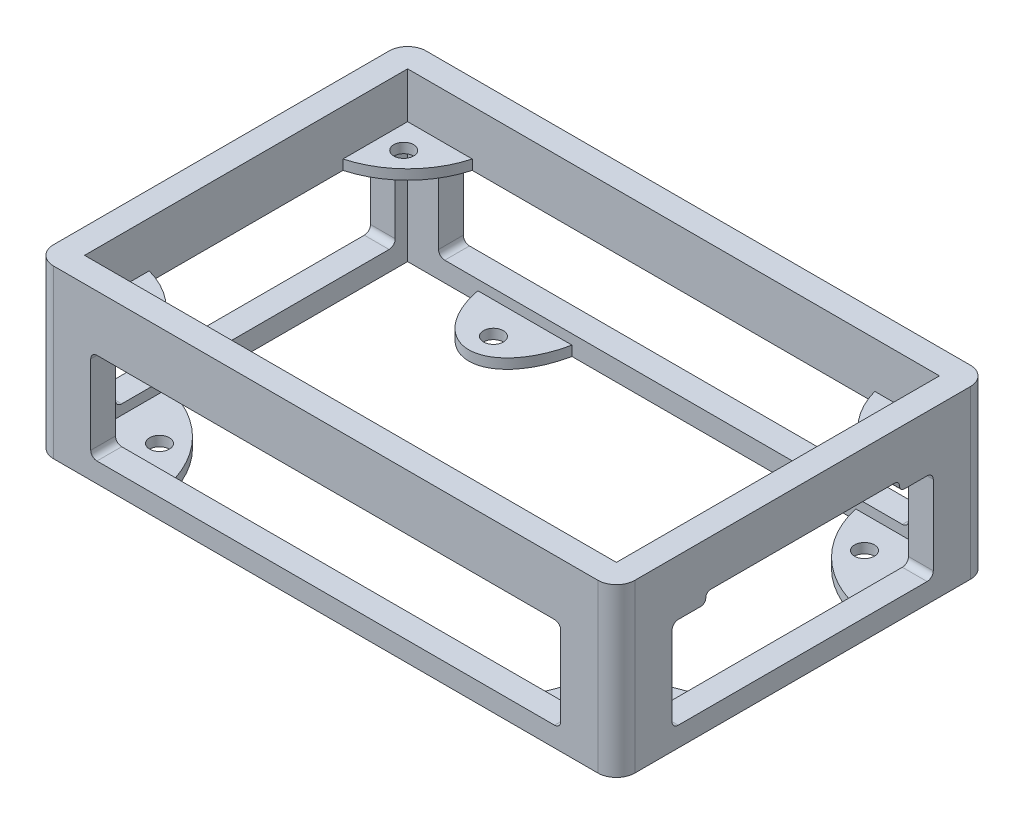
from build123d import *

# Parameters (mm, degrees)
EXTRUDE_1_DEPTH      = 9
EXTRUDE_1_DEPTH_BACK = 18
SKETCH_1_W           = 94
SKETCH_1_H           = 60.24
SKETCH_1_3_R         = 1.6
EXTRUDE_2_DEPTH      = 1.6
SKETCH_2_R           = 1.6
EXTRUDE_3_DEPTH      = 1.6
FILLET_1_R           = 3
SKETCH_3_W           = 42.24
SKETCH_3_H           = 14.8
CUT_EXTRUDE_1_DEPTH  = 4
SKETCH_4_W           = 42.24
SKETCH_4_H           = 14.8
CUT_EXTRUDE_2_DEPTH  = 4
SKETCH_5_W           = 76
SKETCH_5_H           = 14.8
CUT_EXTRUDE_3_DEPTH  = 4
SKETCH_6_W           = 76
SKETCH_6_H           = 14.8
CUT_EXTRUDE_4_DEPTH  = 4
FILLET_2_R           = 1
SKETCH_8_W           = 3
SKETCH_8_H           = 14.8
CUT_EXTRUDE_5_DEPTH  = 4
FILLET_3_R           = 1
SKETCH_9_W           = 31.32633541
SKETCH_9_H           = 1.6
CUT_EXTRUDE_6_DEPTH  = 4
FILLET_5_R           = 0.8


with BuildPart() as part:
    # 草图1 → 凸台-拉伸1 (new, two sides: drawn at the far end of the back side and taken through both)
    with BuildSketch(Plane(origin=(0, 0, 0), x_dir=(1, 0, 0), z_dir=(0, 1, 0)).offset(-EXTRUDE_1_DEPTH_BACK)):
        Rectangle(SKETCH_1_W, SKETCH_1_H)
        Polygon((-43, 15.663167705), (-43, 26.12), (-32.543167705, 26.12), (32.543167705, 26.12), (43, 26.12), (43, 15.663167705), (43, -15.663167705), (43, -26.12), (32.543167705, -26.12), (-32.543167705, -26.12), (-43, -26.12), (-43, -15.663167705), align=None, mode=Mode.SUBTRACT)
    extrude(amount=EXTRUDE_1_DEPTH + EXTRUDE_1_DEPTH_BACK)

    # 草图1<3> → 凸台-拉伸2 (add)
    # profile 1 of 4: a face of its own
    with BuildSketch(Plane(origin=(0, 0, 0), x_dir=(1, 0, 0), z_dir=(0, 1, 0))):
        with BuildLine():
            Line((-32.543167705, 26.12), (-43, 26.12))
            Line((-43, 26.12), (-43, 15.663167705))
            ThreePointArc((-43, 15.663167705), (-36.393398282, 19.513398282), (-32.543167705, 26.12))
        make_face()
        with Locations(Location((-39.3, 21.79, 0), (0, 0, 270))):
            Circle(SKETCH_1_3_R, mode=Mode.SUBTRACT)
    # profile 2 of 4: a face of its own
    with BuildSketch(Plane(origin=(0, 0, 0), x_dir=(1, 0, 0), z_dir=(0, 1, 0))):
        with BuildLine():
            Line((32.543167705, 26.12), (43, 26.12))
            Line((43, 26.12), (43, 15.663167705))
            ThreePointArc((43, 15.663167705), (36.393398282, 19.513398282), (32.543167705, 26.12))
        make_face()
        with Locations(Location((39.3, 21.79, 0), (0, 0, 270))):
            Circle(SKETCH_1_3_R, mode=Mode.SUBTRACT)
    # profile 3 of 4: a face of its own
    with BuildSketch(Plane(origin=(0, 0, 0), x_dir=(1, 0, 0), z_dir=(0, 1, 0))):
        with BuildLine():
            Line((43, -15.663167705), (43, -26.12))
            Line((43, -26.12), (32.543167705, -26.12))
            ThreePointArc((32.543167705, -26.12), (36.393398282, -19.513398282), (43, -15.663167705))
        make_face()
        with Locations(Location((39.3, -21.79, 0), (0, 0, 270))):
            Circle(SKETCH_1_3_R, mode=Mode.SUBTRACT)
    # profile 4 of 4: a face of its own
    with BuildSketch(Plane(origin=(0, 0, 0), x_dir=(1, 0, 0), z_dir=(0, 1, 0))):
        with BuildLine():
            ThreePointArc((-32.543167705, -26.12), (-36.393398282, -19.513398282), (-43, -15.663167705))
            Line((-43, -15.663167705), (-43, -26.12))
            Line((-43, -26.12), (-32.543167705, -26.12))
        make_face()
        with Locations(Location((-39.3, -21.79, 0), (0, 0, 270))):
            Circle(SKETCH_1_3_R, mode=Mode.SUBTRACT)
    extrude(amount=EXTRUDE_2_DEPTH)

    # 草图2 → 凸台-拉伸3 (add)
    # profile 1 of 4: a face of its own
    with BuildSketch(Plane(origin=(0, -18, 0), x_dir=(-1, 0, 0), z_dir=(0, -1, 0))):
        with BuildLine():
            Line((-43, 26.12), (-43, 12.570071225))
            ThreePointArc((-43, 12.570071225), (-34.272077939, 17.392077939), (-29.450071225, 26.12))
            Line((-29.450071225, 26.12), (-43, 26.12))
        make_face()
        with Locations(Location((-36, 21, 0), (0, 0, 90))):
            Circle(SKETCH_2_R, mode=Mode.SUBTRACT)
    # profile 2 of 4: a face of its own
    with BuildSketch(Plane(origin=(0, -18, 0), x_dir=(-1, 0, 0), z_dir=(0, -1, 0))):
        with BuildLine():
            Line((16.416573998, 26.12), (31.641993825, 26.12))
            add(Edge.make_bspline(
                [(16.416573998, 26.12), (24.309284633, -12.12635511), (31.641993825, 26.12)],
                knots=[1.876324373, 1.876324373, 1.876324373, 4.392355682, 4.392355682, 4.392355682], degree=2, weights=[1, 0.307705581, 1]))
        make_face()
        with Locations(Location((24, 21, 0), (0, 0, 90))):
            Circle(SKETCH_2_R, mode=Mode.SUBTRACT)
    # profile 3 of 4: a face of its own
    with BuildSketch(Plane(origin=(0, -18, 0), x_dir=(-1, 0, 0), z_dir=(0, -1, 0))):
        with BuildLine():
            Line((43, -12.570071225), (43, -26.12))
            Line((43, -26.12), (29.450071225, -26.12))
            ThreePointArc((29.450071225, -26.12), (34.272077939, -17.392077939), (43, -12.570071225))
        make_face()
        with Locations(Location((36, -21, 0), (0, 0, 90))):
            Circle(SKETCH_2_R, mode=Mode.SUBTRACT)
    # profile 4 of 4: a face of its own
    with BuildSketch(Plane(origin=(0, -18, 0), x_dir=(-1, 0, 0), z_dir=(0, -1, 0))):
        with BuildLine():
            Line((-43, -26.12), (-29.450071225, -26.12))
            ThreePointArc((-29.450071225, -26.12), (-34.272077939, -17.392077939), (-43, -12.570071225))
            Line((-43, -12.570071225), (-43, -26.12))
        make_face()
        with Locations(Location((-36, -21, 0), (0, 0, 90))):
            Circle(SKETCH_2_R, mode=Mode.SUBTRACT)
    extrude(amount=-EXTRUDE_3_DEPTH)

    # 圆角1
    fillet_1_edges = [part.edges().sort_by_distance(p)[0] for p in [
        (47, -4.5, 30.12),
        (-47, -4.5, 30.12),
        (-47, -4.5, -30.12),
        (47, -4.5, -30.12),
    ]]
    fillet(fillet_1_edges, radius=FILLET_1_R)

    # 草图3 → 切除-拉伸1 (cut)
    with BuildSketch(Plane.ZY.offset(47)):
        with Locations((0, -7.4)):
            Rectangle(SKETCH_3_W, SKETCH_3_H)
    extrude(amount=-CUT_EXTRUDE_1_DEPTH, mode=Mode.SUBTRACT)

    # 草图4 → 切除-拉伸2 (cut)
    with BuildSketch(Plane(origin=(47, 0, 0), x_dir=(0, 0, -1), z_dir=(1, 0, 0))):
        with Locations((0, -7.4)):
            Rectangle(SKETCH_4_W, SKETCH_4_H)
    extrude(amount=-CUT_EXTRUDE_2_DEPTH, mode=Mode.SUBTRACT)

    # 草图5 → 切除-拉伸3 (cut)
    with BuildSketch(Plane.XY.offset(30.12)):
        with Locations((0, -7.4)):
            Rectangle(SKETCH_5_W, SKETCH_5_H)
    extrude(amount=-CUT_EXTRUDE_3_DEPTH, mode=Mode.SUBTRACT)

    # 草图6 → 切除-拉伸4 (cut)
    with BuildSketch(Plane(origin=(0, 0, -30.12), x_dir=(-1, 0, 0), z_dir=(0, 0, -1))):
        with Locations((0, -7.4)):
            Rectangle(SKETCH_6_W, SKETCH_6_H)
    extrude(amount=-CUT_EXTRUDE_4_DEPTH, mode=Mode.SUBTRACT)

    # 圆角2
    fillet_2_edges = [part.edges().sort_by_distance(p)[0] for p in [
        (-45, 0, 21.12),
        (-45, -14.8, 21.12),
        (45, 0, -21.12),
        (45, -14.8, -21.12),
        (45, -14.8, 21.12),
        (45, 0, 21.12),
        (38, 0, 28.12),
        (38, -14.8, 28.12),
        (-38, -14.8, 28.12),
        (-38, 0, 28.12),
        (-38, 0, -28.12),
        (-38, -14.8, -28.12),
        (38, -14.8, -28.12),
        (38, 0, -28.12),
    ]]
    fillet(fillet_2_edges, radius=FILLET_2_R)

    # 草图8 → 切除-拉伸5 (cut)
    with BuildSketch(Plane.ZY.offset(47)):
        with Locations((-22.62, -7.4)):
            Rectangle(SKETCH_8_W, SKETCH_8_H)
    extrude(amount=-CUT_EXTRUDE_5_DEPTH, mode=Mode.SUBTRACT)

    # 圆角3
    fillet_3_edges = [part.edges().sort_by_distance(p)[0] for p in [
        (-45, -14.8, -24.12),
        (-45, 0, -24.12),
    ]]
    fillet(fillet_3_edges, radius=FILLET_3_R)

    # 草图9 → 切除-拉伸6 (cut)
    with BuildSketch(Plane(origin=(47, 0, 0), x_dir=(0, 0, -1), z_dir=(1, 0, 0))):
        with Locations((0, 0.8)):
            Rectangle(SKETCH_9_W, SKETCH_9_H)
    extrude(amount=-CUT_EXTRUDE_6_DEPTH, mode=Mode.SUBTRACT)

    # 圆角5
    # the kernel refuses this fillet: 0.8 mm, written as the material it adds along each edge
    with BuildSketch(Plane(origin=(47, 1.6, 15.663167705), x_dir=(0, -1, 0), z_dir=(-1, 0, 0))) as fillet_5_piece_1:
        with BuildLine():
            CenterArc((FILLET_5_R, -FILLET_5_R), FILLET_5_R, 90, 90)
            Line((0, -FILLET_5_R), (0, 0))
            Line((0, 0), (FILLET_5_R, 0))
        make_face()
    extrude(amount=4)
    with BuildSketch(Plane(origin=(47, 1.6, -15.663167705), x_dir=(0, -1, 0), z_dir=(-1, 0, 0))) as fillet_5_piece_2:
        with BuildLine():
            CenterArc((FILLET_5_R, FILLET_5_R), FILLET_5_R, 180, 90)
            Line((0, FILLET_5_R), (0, 0))
            Line((0, 0), (FILLET_5_R, 0))
        make_face()
    extrude(amount=4)
    # the kernel refuses this fillet: 0.8 mm, written as the material it takes off along each edge
    with BuildSketch(Plane(origin=(49, 0, -15.663167705), x_dir=(0, 0, -1), z_dir=(-1, 0, 0))) as fillet_5_2_piece_1:
        with BuildLine():
            CenterArc((FILLET_5_R, -FILLET_5_R), FILLET_5_R, 90, 90)
            Line((0, -FILLET_5_R), (0, 0))
            Line((0, 0), (FILLET_5_R, 0))
        make_face()
    extrude(amount=9.4, mode=Mode.SUBTRACT)
    with BuildSketch(Plane(origin=(49, 0, 15.663167705), x_dir=(0, 0, 1), z_dir=(-1, 0, 0))) as fillet_5_2_piece_2:
        with BuildLine():
            CenterArc((FILLET_5_R, FILLET_5_R), FILLET_5_R, 180, 90)
            Line((0, FILLET_5_R), (0, 0))
            Line((0, 0), (FILLET_5_R, 0))
        make_face()
    extrude(amount=9.4, mode=Mode.SUBTRACT)


solid = part.part
